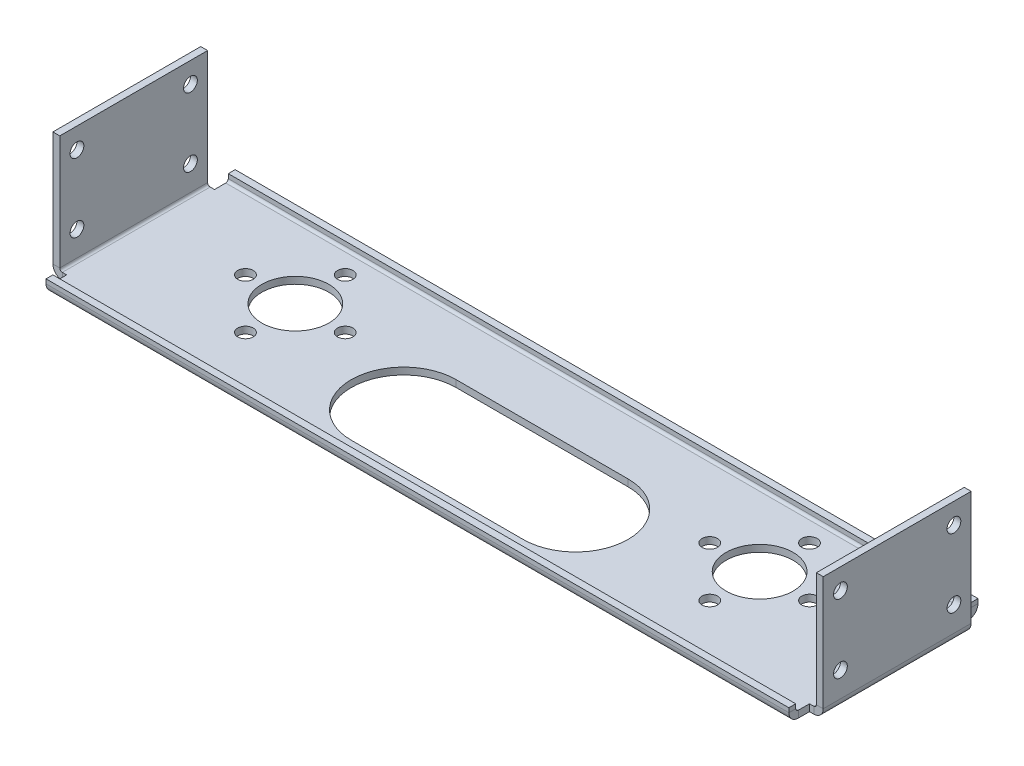
from build123d import *

# Parameters (mm, degrees)
BASE_FLANGE1_START             = -2
BASE_FLANGE1_OUTLINE_R         = 2.25
BASE_FLANGE1_OUTLINE_R_2       = 9.75
BASE_FLANGE1_DEPTH             = 2
EDGE_FLANGE1_STRIP_W           = 9.4732
EDGE_FLANGE1_STRIP_H           = 2
EDGE_FLANGE1_STRIP_CUT_DEPTH   = 220
EDGE_FLANGE1_STRIP_2_W         = 9.4732
EDGE_FLANGE1_STRIP_2_H         = 2
EDGE_FLANGE1_STRIP_CUT_2_DEPTH = 220
EDGE_FLANGE1_DEPTH             = 220
EDGE_FLANGE1_BEND_DEPTH        = 220
EDGE_FLANGE2_STRIP_W           = 9.4732
EDGE_FLANGE2_STRIP_H           = 2
EDGE_FLANGE2_STRIP_CUT_DEPTH   = 43
EDGE_FLANGE2_STRIP_2_W         = 9.4732
EDGE_FLANGE2_STRIP_2_H         = 2
EDGE_FLANGE2_STRIP_CUT_2_DEPTH = 43
EDGE_FLANGE2_DEPTH             = 43
EDGE_FLANGE2_BEND_DEPTH        = 43
SKETCH19_R                     = 2
CUT_EXTRUDE3_DEPTH             = 229.228503917
CUT_EXTRUDE4_DEPTH             = 121.814941129


# Read off the part's stored shape, not the designer's step: Base-Flange1
# Sheet-metal steps are written as plain solids
with BuildPart() as part:
    # Base-Flange1 outline → Base-Flange1 (new body)
    with BuildSketch(Plane(origin=(0, 0, 0), x_dir=(1, 0, 0), z_dir=(0, 1, 0)).offset(BASE_FLANGE1_START)):
        Polygon((108, 23.5), (110, 23.5), (110, 27.5), (-110, 27.5), (-110, 23.5), (-108, 23.5), (-108, 21.5), (-110, 21.5), (-110, -21.5), (-108, -21.5), (-108, -23.5), (-110, -23.5), (-110, -27.5), (110, -27.5), (110, -23.5), (108, -23.5), (108, -21.5), (110, -21.5), (110, 21.5), (108, 21.5), align=None)
        with Locations((-67.5, -10)):
            Circle(BASE_FLANGE1_OUTLINE_R, mode=Mode.SUBTRACT)
        with BuildLine():
            ThreePointArc((-25, -21.75), (-40.25, -6.5), (-25, 8.75))
            Line((-25, 8.75), (25, 8.75))
            ThreePointArc((25, 8.75), (40.25, -6.5), (25, -21.75))
            Line((25, -21.75), (-25, -21.75))
        make_face(mode=Mode.SUBTRACT)
        with Locations((67.5, -10)):
            Circle(BASE_FLANGE1_OUTLINE_R, mode=Mode.SUBTRACT)
        with Locations((-82, 4.5)):
            Circle(BASE_FLANGE1_OUTLINE_R, mode=Mode.SUBTRACT)
        with Locations((-67.5, 4.5)):
            Circle(BASE_FLANGE1_OUTLINE_R_2, mode=Mode.SUBTRACT)
        with Locations((-53, 4.5)):
            Circle(BASE_FLANGE1_OUTLINE_R, mode=Mode.SUBTRACT)
        with Locations((-67.5, 19)):
            Circle(BASE_FLANGE1_OUTLINE_R, mode=Mode.SUBTRACT)
        with Locations((53, 4.5)):
            Circle(BASE_FLANGE1_OUTLINE_R, mode=Mode.SUBTRACT)
        with Locations((67.5, 4.5)):
            Circle(BASE_FLANGE1_OUTLINE_R_2, mode=Mode.SUBTRACT)
        with Locations((82, 4.5)):
            Circle(BASE_FLANGE1_OUTLINE_R, mode=Mode.SUBTRACT)
        with Locations((67.5, 19)):
            Circle(BASE_FLANGE1_OUTLINE_R, mode=Mode.SUBTRACT)
    extrude(amount=BASE_FLANGE1_DEPTH)

    # Edge-Flange1 strip (across the edge) → Edge-Flange1 strip cut (cut)
    with BuildSketch(Plane(origin=(110, 0, -27.5), x_dir=(0, 0, 1), z_dir=(-1, 0, 0))):
        with Locations((-2, -1)):
            Rectangle(EDGE_FLANGE1_STRIP_W, EDGE_FLANGE1_STRIP_H)
    extrude(amount=EDGE_FLANGE1_STRIP_CUT_DEPTH, mode=Mode.SUBTRACT)

    # Edge-Flange1 strip 2 (across the edge) → Edge-Flange1 strip cut 2 (cut)
    with BuildSketch(Plane(origin=(-110, 0, 27.5), x_dir=(0, 0, -1), z_dir=(1, 0, 0))):
        with Locations((-2, -1)):
            Rectangle(EDGE_FLANGE1_STRIP_2_W, EDGE_FLANGE1_STRIP_2_H)
    extrude(amount=EDGE_FLANGE1_STRIP_CUT_2_DEPTH, mode=Mode.SUBTRACT)

    # Edge-Flange1 section (across the edge) → Edge-Flange1 (add)
    with BuildSketch(Plane(origin=(110, 0, -27.5), x_dir=(0, 0, 1), z_dir=(-1, 0, 0))):
        with BuildLine():
            Line((0, 0.7366), (0, 2))
            Line((0, 2), (2, 2))
            Line((2, 2), (2, 0.7366))
            ThreePointArc((2, 0.7366), (2.215745145, 0.215745145), (2.7366, 0))
            Line((2.7366, 0), (2.7366, -2))
            ThreePointArc((2.7366, -2), (0.801531583, -1.198468417), (0, 0.7366))
        make_face()
    extrude(amount=EDGE_FLANGE1_DEPTH)

    # Edge-Flange1 section 2 (across the edge) → Edge-Flange1 bend (add)
    with BuildSketch(Plane(origin=(-110, 0, 27.5), x_dir=(0, 0, -1), z_dir=(1, 0, 0))):
        with BuildLine():
            Line((0, 0.7366), (0, 2))
            Line((0, 2), (2, 2))
            Line((2, 2), (2, 0.7366))
            ThreePointArc((2, 0.7366), (2.215745145, 0.215745145), (2.7366, 0))
            Line((2.7366, 0), (2.7366, -2))
            ThreePointArc((2.7366, -2), (0.801531583, -1.198468417), (0, 0.7366))
        make_face()
    extrude(amount=EDGE_FLANGE1_BEND_DEPTH)

    # Edge-Flange2 strip (across the edge) → Edge-Flange2 strip cut (cut)
    with BuildSketch(Plane(origin=(-110, 0, -21.5), x_dir=(1, 0, 0), z_dir=(0, 0, 1))):
        with Locations((-4, -1)):
            Rectangle(EDGE_FLANGE2_STRIP_W, EDGE_FLANGE2_STRIP_H)
    extrude(amount=EDGE_FLANGE2_STRIP_CUT_DEPTH, mode=Mode.SUBTRACT)

    # Edge-Flange2 strip 2 (across the edge) → Edge-Flange2 strip cut 2 (cut)
    with BuildSketch(Plane(origin=(110, 0, 21.5), x_dir=(-1, 0, 0), z_dir=(0, 0, -1))):
        with Locations((-4, -1)):
            Rectangle(EDGE_FLANGE2_STRIP_2_W, EDGE_FLANGE2_STRIP_2_H)
    extrude(amount=EDGE_FLANGE2_STRIP_CUT_2_DEPTH, mode=Mode.SUBTRACT)

    # Edge-Flange2 section (across the edge) → Edge-Flange2 (add)
    with BuildSketch(Plane(origin=(-110, 0, -21.5), x_dir=(1, 0, 0), z_dir=(0, 0, 1))):
        with BuildLine():
            Line((-2, 0.7366), (-2, 34))
            Line((-2, 34), (0, 34))
            Line((0, 34), (0, 0.7366))
            ThreePointArc((0, 0.7366), (0.215745145, 0.215745145), (0.7366, 0))
            Line((0.7366, 0), (0.7366, -2))
            ThreePointArc((0.7366, -2), (-1.198468417, -1.198468417), (-2, 0.7366))
        make_face()
    extrude(amount=EDGE_FLANGE2_DEPTH)

    # Edge-Flange2 section 2 (across the edge) → Edge-Flange2 bend (add)
    with BuildSketch(Plane(origin=(110, 0, 21.5), x_dir=(-1, 0, 0), z_dir=(0, 0, -1))):
        with BuildLine():
            Line((-2, 0.7366), (-2, 34))
            Line((-2, 34), (0, 34))
            Line((0, 34), (0, 0.7366))
            ThreePointArc((0, 0.7366), (0.215745145, 0.215745145), (0.7366, 0))
            Line((0.7366, 0), (0.7366, -2))
            ThreePointArc((0.7366, -2), (-1.198468417, -1.198468417), (-2, 0.7366))
        make_face()
    extrude(amount=EDGE_FLANGE2_BEND_DEPTH)

    # Sketch19 → Cut-Extrude3 (cut, through all)
    with BuildSketch(Plane.ZY.offset(112)):
        with Locations(Location((-16.5, 28, 0), (0, 0, 270))):
            Circle(SKETCH19_R)
        with Locations(Location((-16.5, 8, 0), (0, 0, 270))):
            Circle(SKETCH19_R)
        with Locations(Location((16.5, 8, 0), (0, 0, 270))):
            Circle(SKETCH19_R)
        with Locations(Location((16.5, 28, 0), (0, 0, 270))):
            Circle(SKETCH19_R)
    extrude(amount=-CUT_EXTRUDE3_DEPTH, mode=Mode.SUBTRACT)

    # Sketch22 → Cut-Extrude4 (cut, through all)
    with BuildSketch(Plane.XZ.offset(2)):
        Polygon((-108, 23.5), (-110, 23.5), (-110, 24.7634), (-110, 27.5), (-108, 27.5), align=None)
        Polygon((-108, -23.5), (-108, -27.5), (-110, -27.5), (-110, -24.7634), (-110, -23.5), align=None)
        Polygon((108, -23.5), (110, -23.5), (110, -24.7634), (110, -27.5), (108, -27.5), align=None)
        Polygon((108, 23.5), (108, 27.5), (110, 27.5), (110, 24.7634), (110, 23.5), align=None)
    extrude(amount=-CUT_EXTRUDE4_DEPTH, mode=Mode.SUBTRACT)


solid = part.part
